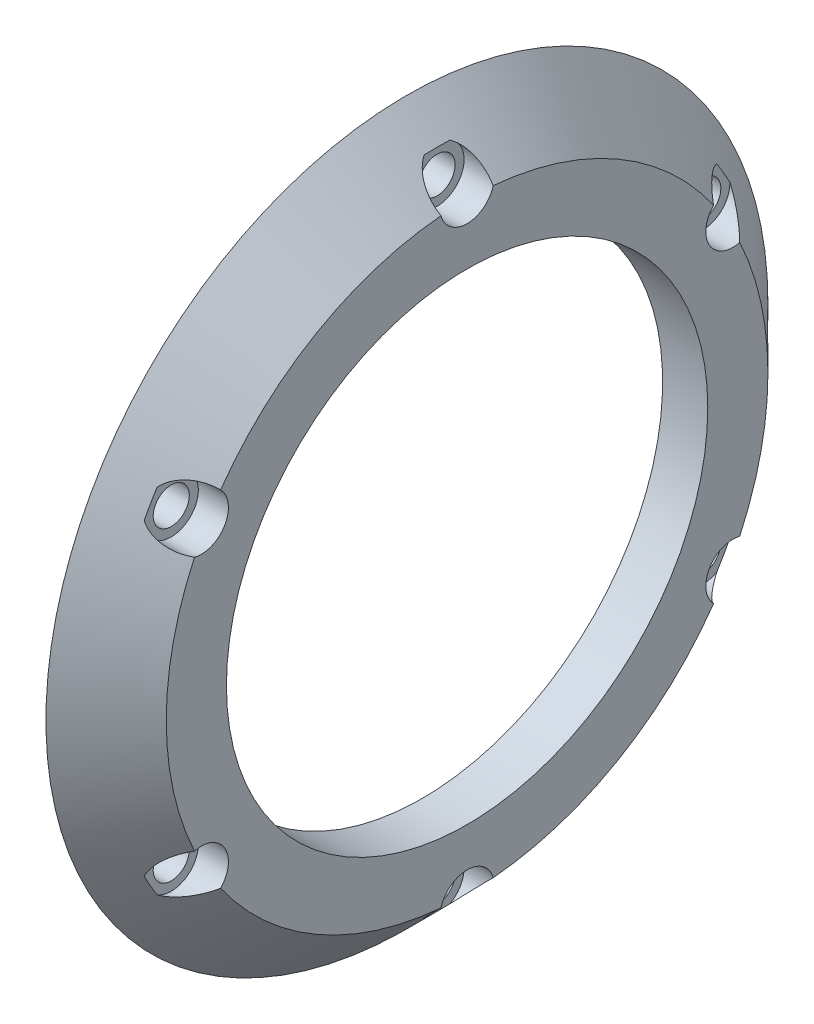
from build123d import *

# Parameters (mm, degrees)
CROQUIS1_R              = 60
CROQUIS1_R_2            = 40
CROQUIS1_R_3            = 3
SALIENTE_EXTRUIR1_DEPTH = 10
CROQUIS2_R              = 47
CORTAR_EXTRUIR1_DEPTH   = 2.5
CHAFL_N1_SIZE           = 10
CROQUIS5_R              = 4.5
CORTAR_EXTRUIR2_DEPTH   = 5


with BuildPart() as part:
    # Croquis1 → Saliente-Extruir1 (new body)
    with BuildSketch(Plane(origin=(0, 0, 0), x_dir=(0, 0, -1), z_dir=(1, 0, 0))):
        Circle(CROQUIS1_R)
        Circle(CROQUIS1_R_2, mode=Mode.SUBTRACT)
        with Locations((0, 51)):
            Circle(CROQUIS1_R_3, mode=Mode.SUBTRACT)
        with Locations((44.167295593, 25.5)):
            Circle(CROQUIS1_R_3, mode=Mode.SUBTRACT)
        with Locations((44.167295593, -25.5)):
            Circle(CROQUIS1_R_3, mode=Mode.SUBTRACT)
        with Locations((0, -51)):
            Circle(CROQUIS1_R_3, mode=Mode.SUBTRACT)
        with Locations((-44.167295593, -25.5)):
            Circle(CROQUIS1_R_3, mode=Mode.SUBTRACT)
        with Locations((-44.167295593, 25.5)):
            Circle(CROQUIS1_R_3, mode=Mode.SUBTRACT)
    extrude(amount=SALIENTE_EXTRUIR1_DEPTH)

    # Croquis2 → Cortar-Extruir1 (cut)
    with BuildSketch(Plane.ZY):
        Circle(CROQUIS2_R)
    extrude(amount=-CORTAR_EXTRUIR1_DEPTH, mode=Mode.SUBTRACT)

    # Chaflán1
    # the kernel refuses this chamfer: 10 mm, written as the material it takes off along each edge
    with BuildSketch(Plane(origin=(10, 0, 0), x_dir=(0, 0, -1), z_dir=(0, -1, 0))) as chafl_n1_piece_1:
        Polygon((60, -CHAFL_N1_SIZE), (60 - CHAFL_N1_SIZE, 0), (60, 0), align=None)
    revolve(axis=Axis((10, 0, 0), (1, 0, 0)), mode=Mode.SUBTRACT)

    # Croquis5 → Cortar-Extruir2 (cut)
    with BuildSketch(Plane(origin=(10, 0, 0), x_dir=(0, 0, -1), z_dir=(1, 0, 0))):
        with Locations((0, 51)):
            Circle(CROQUIS5_R)
        with Locations((44.167295593, 25.5)):
            Circle(CROQUIS5_R)
        with Locations((44.167295593, -25.5)):
            Circle(CROQUIS5_R)
        with Locations((0, -51)):
            Circle(CROQUIS5_R)
        with Locations((-44.167295593, -25.5)):
            Circle(CROQUIS5_R)
        with Locations((-44.167295593, 25.5)):
            Circle(CROQUIS5_R)
    extrude(amount=-CORTAR_EXTRUIR2_DEPTH, mode=Mode.SUBTRACT)


solid = part.part
